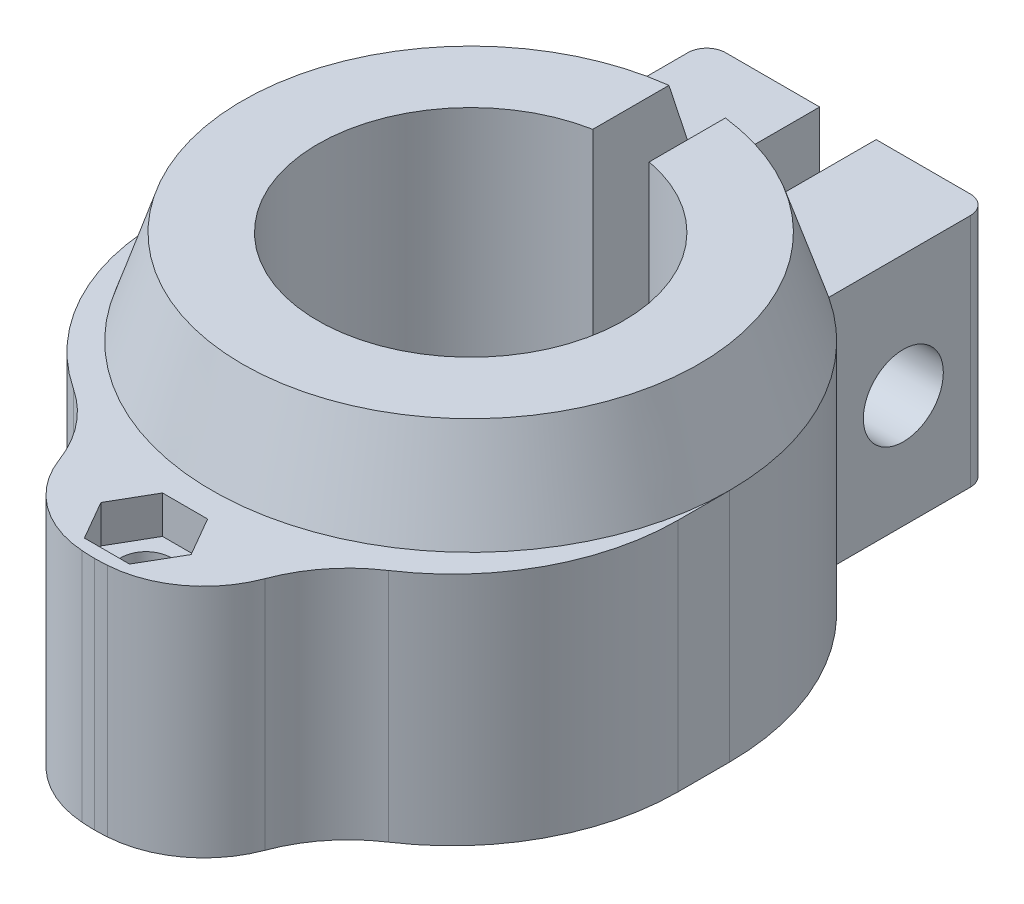
from build123d import *

# Parameters (mm, degrees)
SKETCH2_W               = 6
SKETCH2_H               = 60
CUT_EXTRUDE1_DEPTH      = 67.520673478
CUT_EXTRUDE2_DEPTH      = 69.366658541
CUT_EXTRUDE2_DEPTH_BACK = 69.366658541
SKETCH3_R               = 4.25
SKETCH6_R               = 2.65
CUT_EXTRUDE5_DEPTH      = 67.520673599
CUT_EXTRUDE6_DEPTH      = 4
CUT_EXTRUDE7_DEPTH      = 62.846584554
FILLET1_R               = 28
SKETCH12_W              = 12
SKETCH12_H              = 3
BOSS_EXTRUDE1_DEPTH     = 25
CHAMFER1_SIZE           = 0.5
FILLET2_R               = 2
SKETCH13_R              = 4.625
CUT_EXTRUDE8_DEPTH      = 53.561734699
SKETCH15_R              = 2.65
BOSS_EXTRUDE2_DEPTH     = 0.2
SKETCH16_R              = 15
CUT_EXTRUDE9_DEPTH      = 55.660186193
FILLET3_R               = 11
FILLET4_R               = 24


with BuildPart() as part:
    # Sketch1 → Revolve1 (revolve)
    with BuildSketch(Plane.XY, mode=Mode.PRIVATE) as revolve1_sk:
        Polygon((16.25, 0), (40, 0), (40, 25), (27.5, 25), (24.25, 35), (16.25, 35), align=None)
    revolve(revolve1_sk.sketch.rotate(Axis((0, 0, 0), (0, 1, 0)), 90), axis=Axis((0, 0, 0), (0, 1, 0)))

    # Sketch2 → Cut-Extrude1 (cut, through all)
    with BuildSketch(Plane.XZ):
        with Locations((0, -30)):
            Rectangle(SKETCH2_W, SKETCH2_H)
    extrude(amount=-CUT_EXTRUDE1_DEPTH, mode=Mode.SUBTRACT)

    # Sketch3 → Cut-Extrude2 (cut, two sides: drawn at the far end of the back side and taken through both)
    with BuildSketch(Plane(origin=(-3, 0, 0), x_dir=(0, 0, -1), z_dir=(1, 0, 0)).offset(-CUT_EXTRUDE2_DEPTH_BACK)):
        with Locations((30.970676254, 12)):
            Circle(SKETCH3_R)
    extrude(amount=CUT_EXTRUDE2_DEPTH + CUT_EXTRUDE2_DEPTH_BACK, mode=Mode.SUBTRACT)

    # Sketch6 → Cut-Extrude5 (cut, through all)
    with BuildSketch(Plane.XZ):
        with Locations(Location((0, 34.5, 0), (0, 0, 270))):
            Circle(SKETCH6_R)
    extrude(amount=-CUT_EXTRUDE5_DEPTH, mode=Mode.SUBTRACT)

    # Sketch7 → Cut-Extrude6 (cut)
    with BuildSketch(Plane(origin=(0, 25, 0), x_dir=(1, 0, 0), z_dir=(0, 1, 0))):
        Polygon((-2.396003617, -30.35), (-4.792007234, -34.5), (-2.396003617, -38.65), (2.396003617, -38.65), (4.792007234, -34.5), (2.396003617, -30.35), align=None)
    extrude(amount=-CUT_EXTRUDE6_DEPTH, mode=Mode.SUBTRACT)

    # Sketch8 → Cut-Extrude7 (cut, through all)
    with BuildSketch(Plane(origin=(0, 25, 0), x_dir=(1, 0, 0), z_dir=(0, 1, 0))):
        with BuildLine():
            Line((-27.5, 0), (-27.5, -50))
            Line((-27.5, -50), (-50, -50))
            Line((-50, -50), (-50, 70))
            Line((-50, 70), (50, 70))
            Line((50, 70), (50, -50))
            Line((50, -50), (27.5, -50))
            Line((27.5, -50), (27.5, 0))
            ThreePointArc((27.5, 0), (24.173849507, 13.110110602), (15, 23.048861143))
            Line((15, 23.048861143), (15, 60))
            Line((15, 60), (-15, 60))
            Line((-15, 60), (-15, 23.048861143))
            ThreePointArc((-15, 23.048861143), (-24.173849507, 13.110110602), (-27.5, 0))
        make_face()
    extrude(amount=-CUT_EXTRUDE7_DEPTH, mode=Mode.SUBTRACT)

    # Fillet1
    # the kernel refuses this fillet: 28 mm, written as the material it takes off along each edge
    with BuildSketch(Plane(origin=(27.5, -77.857831737, 29.047375097), x_dir=(-0.9365360560407987, 0, 0.3505712705507198), z_dir=(0, 1, 0))) as fillet1_piece_1:
        with BuildLine():
            CenterArc((20.243036252, -25.791236836), FILLET1_R, 67.089723989, 92.388015463)
            Line((-5.979973318, -15.975241261), (0, 0))
            ThreePointArc((0, 0), (15.571566347, 3.155375949), (31.143132695, 0))
        make_face()
    extrude(amount=180.715663474, mode=Mode.SUBTRACT)
    with BuildSketch(Plane(origin=(-27.5, -77.857831737, 29.047375097), x_dir=(0, 0, -1), z_dir=(0, 1, 0))) as fillet1_piece_2:
        with BuildLine():
            CenterArc((17.057796288, -28), FILLET1_R, 90, 92.388015463)
            ThreePointArc((-10.917887598, -29.166666667), (-8.414067145, -13.477149178), (0, 0))
            Line((0, 0), (17.057796288, 0))
        make_face()
    extrude(amount=180.715663474, mode=Mode.SUBTRACT)

    # Sketch12 → Boss-Extrude1 (add)
    with BuildSketch(Plane(origin=(0, 25, 0), x_dir=(1, 0, 0), z_dir=(0, 1, 0))):
        with Locations((-9, 38.580992435)):
            Rectangle(SKETCH12_W, SKETCH12_H)
        with Locations((9, 38.580992435)):
            Rectangle(SKETCH12_W, SKETCH12_H)
    extrude(amount=-BOSS_EXTRUDE1_DEPTH)

    # Chamfer1
    chamfer1_edges = [part.edges().sort_by_distance(p)[0] for p in [
        (0, 0, 16.25),
    ]]
    chamfer(chamfer1_edges, length=CHAMFER1_SIZE)

    # Fillet2
    fillet2_edges = [part.edges().sort_by_distance(p)[0] for p in [
        (-15, 12.5, -40.080992435),
        (15, 12.5, -40.080992435),
    ]]
    fillet(fillet2_edges, radius=FILLET2_R)

    # Sketch13 → Cut-Extrude8 (cut, through all)
    with BuildSketch(Plane(origin=(0, 15, 0), x_dir=(1, 0, 0), z_dir=(0, 1, 0))):
        with Locations(Location((0, -34.5, 0), (0, 0, 270))):
            Circle(SKETCH13_R)
    extrude(amount=-CUT_EXTRUDE8_DEPTH, mode=Mode.SUBTRACT)

    # Sketch15 → Boss-Extrude2 (add)
    with BuildSketch(Plane.XZ.offset(-15)):
        with Locations(Location((0, 34.5, 0), (0, 0, 270))):
            Circle(SKETCH15_R)
    extrude(amount=-BOSS_EXTRUDE2_DEPTH)

    # Sketch16 → Cut-Extrude9 (cut, through all)
    with BuildSketch(Plane(origin=(0, 25, 0), x_dir=(1, 0, 0), z_dir=(0, 1, 0))):
        with Locations((25, -38)):
            Circle(SKETCH16_R)
        with Locations((-25, -38)):
            Circle(SKETCH16_R)
    extrude(amount=-CUT_EXTRUDE9_DEPTH, mode=Mode.SUBTRACT)

    # Fillet3
    fillet3_edges = [part.edges().sort_by_distance(p)[0] for p in [
        (10.000096358, 12.5, 37.946234534),
        (-10.000096358, 12.5, 37.946234534),
    ]]
    fillet(fillet3_edges, radius=FILLET3_R)

    # Fillet4
    fillet4_edges = [part.edges().sort_by_distance(p)[0] for p in [
        (-25.243486575, 12.5, 23.001976321),
        (25.243486575, 12.5, 23.001976321),
    ]]
    fillet(fillet4_edges, radius=FILLET4_R)


solid = part.part
